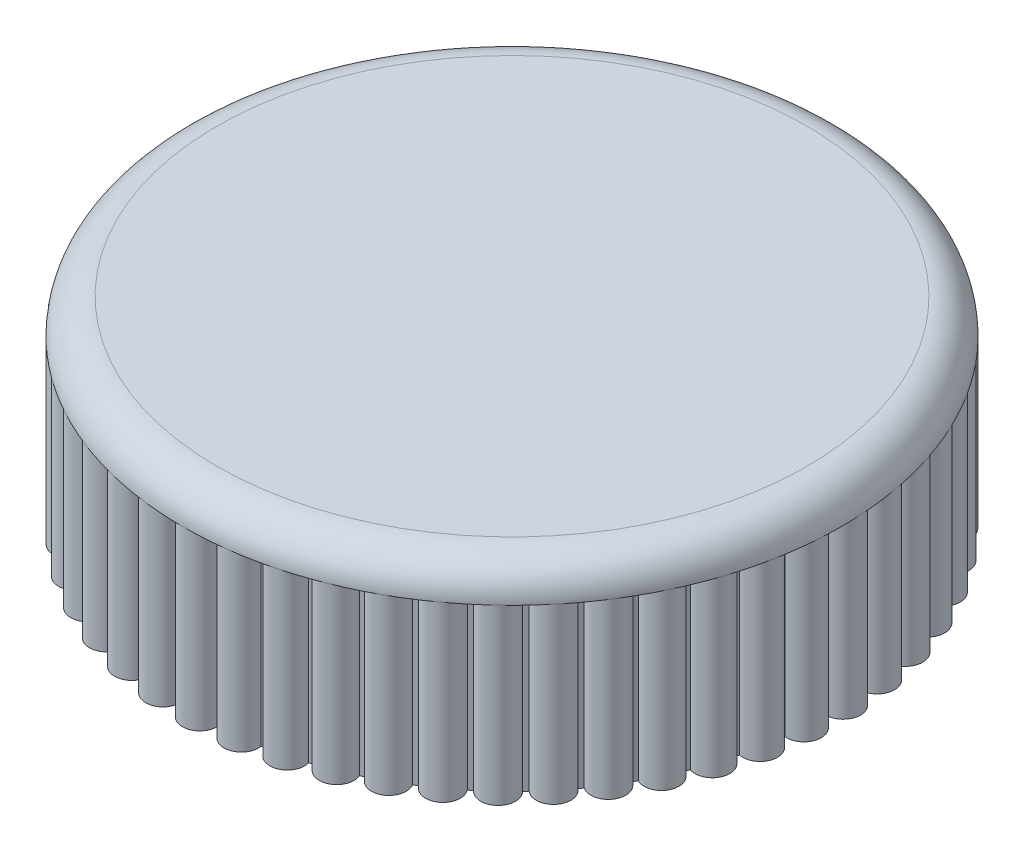
from build123d import *

# Parameters (mm, degrees)
BOSS_EXTRUDE1_DEPTH = 5
SKETCH2_R           = 9.5
BOSS_EXTRUDE2_DEPTH = 1
FILLET1_R           = 1
SKETCH3_R           = 7.5
CUT_EXTRUDE1_DEPTH  = 4


with BuildPart() as part:
    # Sketch1 → Boss-Extrude1 (new body)
    with BuildSketch(Plane(origin=(0, 0, 0), x_dir=(1, 0, 0), z_dir=(0, 1, 0))):
        with BuildLine():
            ThreePointArc((-0.499807062, 8.986111111), (-0.565114676, 8.982240556), (-0.630392429, 8.977895376))
            ThreePointArc((-0.630392429, 8.977895376), (-1.190665719, 9.425089662), (-1.622124296, 8.852610506))
            ThreePointArc((-1.622124296, 8.852610506), (-1.686431831, 8.840585257), (-1.750650255, 8.828092868))
            ThreePointArc((-1.750650255, 8.828092868), (-2.362553928, 9.201540031), (-2.718859662, 8.579498945))
            ThreePointArc((-2.718859662, 8.579498945), (-2.781152949, 8.559508647), (-2.84329928, 8.539066062))
            ThreePointArc((-2.84329928, 8.539066062), (-3.497183251, 8.832876616), (-3.772716986, 8.17108356))
            ThreePointArc((-3.772716986, 8.17108356), (-3.832013624, 8.143443472), (-3.891107777, 8.115373083))
            ThreePointArc((-3.891107777, 8.115373083), (-4.576659904, 8.32491346), (-4.76707631, 7.633805306))
            ThreePointArc((-4.76707631, 7.633805306), (-4.822441155, 7.59895133), (-4.87755118, 7.563695822))
            ThreePointArc((-4.87755118, 7.563695822), (-5.583959897, 7.685661447), (-5.686255993, 6.976137382))
            ThreePointArc((-5.686255993, 6.976137382), (-5.736815908, 6.934619185), (-5.787072687, 6.89273456))
            ThreePointArc((-5.787072687, 6.89273456), (-6.503197506, 6.925201961), (-6.515760022, 6.208451605))
            ThreePointArc((-6.515760022, 6.208451605), (-6.560717647, 6.160923953), (-6.605328601, 6.113070757))
            ThreePointArc((-6.605328601, 6.113070757), (-7.319875806, 6.055527903), (-7.242506623, 5.342854837))
            ThreePointArc((-7.242506623, 5.342854837), (-7.281152949, 5.290067271), (-7.319414537, 5.237000175))
            ThreePointArc((-7.319414537, 5.237000175), (-8.021115292, 5.090354552), (-7.855034569, 4.392998057))
            ThreePointArc((-7.855034569, 4.392998057), (-7.88676012, 4.335783067), (-7.918068933, 4.278338973))
            ThreePointArc((-7.918068933, 4.278338973), (-8.595856998, 4.04490327), (-8.343683926, 3.373861073))
            ThreePointArc((-8.343683926, 3.373861073), (-8.367988373, 3.313120974), (-8.391850652, 3.252205809))
            ThreePointArc((-8.391850652, 3.252205809), (-9.035036905, 2.935661447), (-8.700748404, 2.301516284))
            ThreePointArc((-8.700748404, 2.301516284), (-8.71724845, 2.238208984), (-8.733287874, 2.174783417))
            ThreePointArc((-8.733287874, 2.174783417), (-9.331728882, 1.780122489), (-8.920596882, 1.192875209))
            ThreePointArc((-8.920596882, 1.192875209), (-8.929032312, 1.127999102), (-8.936995928, 1.063063392))
            ThreePointArc((-8.936995928, 1.063063392), (-9.48125392, 0.596509936), (-8.999762219, 0.065421779))
            ThreePointArc((-8.999762219, 0.065421779), (-9, 0), (-8.999762219, -0.065421779))
            ThreePointArc((-8.999762219, -0.065421779), (-9.48125392, -0.596509936), (-8.936995928, -1.063063392))
            ThreePointArc((-8.936995928, -1.063063392), (-8.929032312, -1.127999102), (-8.920596882, -1.192875209))
            ThreePointArc((-8.920596882, -1.192875209), (-9.331728882, -1.780122489), (-8.733287874, -2.174783417))
            ThreePointArc((-8.733287874, -2.174783417), (-8.71724845, -2.238208984), (-8.700748404, -2.301516284))
            ThreePointArc((-8.700748404, -2.301516284), (-9.035036905, -2.935661447), (-8.391850652, -3.252205809))
            ThreePointArc((-8.391850652, -3.252205809), (-8.367988373, -3.313120974), (-8.343683926, -3.373861073))
            ThreePointArc((-8.343683926, -3.373861073), (-8.595856998, -4.04490327), (-7.918068933, -4.278338973))
            ThreePointArc((-7.918068933, -4.278338973), (-7.88676012, -4.335783067), (-7.855034569, -4.392998057))
            ThreePointArc((-7.855034569, -4.392998057), (-8.021115292, -5.090354552), (-7.319414537, -5.237000175))
            ThreePointArc((-7.319414537, -5.237000175), (-7.281152949, -5.290067271), (-7.242506623, -5.342854837))
            ThreePointArc((-7.242506623, -5.342854837), (-7.319875806, -6.055527903), (-6.605328601, -6.113070757))
            ThreePointArc((-6.605328601, -6.113070757), (-6.560717647, -6.160923953), (-6.515760022, -6.208451605))
            ThreePointArc((-6.515760022, -6.208451605), (-6.503197506, -6.925201961), (-5.787072687, -6.89273456))
            ThreePointArc((-5.787072687, -6.89273456), (-5.736815908, -6.934619185), (-5.686255993, -6.976137382))
            ThreePointArc((-5.686255993, -6.976137382), (-5.583959897, -7.685661447), (-4.87755118, -7.563695822))
            ThreePointArc((-4.87755118, -7.563695822), (-4.822441155, -7.59895133), (-4.76707631, -7.633805306))
            ThreePointArc((-4.76707631, -7.633805306), (-4.576659904, -8.32491346), (-3.891107777, -8.115373083))
            ThreePointArc((-3.891107777, -8.115373083), (-3.832013624, -8.143443472), (-3.772716986, -8.17108356))
            ThreePointArc((-3.772716986, -8.17108356), (-3.497183251, -8.832876616), (-2.84329928, -8.539066062))
            ThreePointArc((-2.84329928, -8.539066062), (-2.781152949, -8.559508647), (-2.718859662, -8.579498945))
            ThreePointArc((-2.718859662, -8.579498945), (-2.362553928, -9.201540031), (-1.750650255, -8.828092868))
            ThreePointArc((-1.750650255, -8.828092868), (-1.686431831, -8.840585257), (-1.622124296, -8.852610506))
            ThreePointArc((-1.622124296, -8.852610506), (-1.190665719, -9.425089662), (-0.630392429, -8.977895376))
            ThreePointArc((-0.630392429, -8.977895376), (-0.565114676, -8.982240556), (-0.499807062, -8.986111111))
            ThreePointArc((-0.499807062, -8.986111111), (0, -9.5), (0.499807062, -8.986111111))
            ThreePointArc((0.499807062, -8.986111111), (0.565114676, -8.982240556), (0.630392429, -8.977895376))
            ThreePointArc((0.630392429, -8.977895376), (1.190665719, -9.425089662), (1.622124296, -8.852610506))
            ThreePointArc((1.622124296, -8.852610506), (1.686431831, -8.840585257), (1.750650255, -8.828092868))
            ThreePointArc((1.750650255, -8.828092868), (2.362553928, -9.201540031), (2.718859662, -8.579498945))
            ThreePointArc((2.718859662, -8.579498945), (2.781152949, -8.559508647), (2.84329928, -8.539066062))
            ThreePointArc((2.84329928, -8.539066062), (3.497183251, -8.832876616), (3.772716986, -8.17108356))
            ThreePointArc((3.772716986, -8.17108356), (3.832013624, -8.143443472), (3.891107777, -8.115373083))
            ThreePointArc((3.891107777, -8.115373083), (4.576659904, -8.32491346), (4.76707631, -7.633805306))
            ThreePointArc((4.76707631, -7.633805306), (4.822441155, -7.59895133), (4.87755118, -7.563695822))
            ThreePointArc((4.87755118, -7.563695822), (5.583959897, -7.685661447), (5.686255993, -6.976137382))
            ThreePointArc((5.686255993, -6.976137382), (5.736815908, -6.934619185), (5.787072687, -6.89273456))
            ThreePointArc((5.787072687, -6.89273456), (6.503197506, -6.925201961), (6.515760022, -6.208451605))
            ThreePointArc((6.515760022, -6.208451605), (6.560717647, -6.160923953), (6.605328601, -6.113070757))
            ThreePointArc((6.605328601, -6.113070757), (7.319875806, -6.055527903), (7.242506623, -5.342854837))
            ThreePointArc((7.242506623, -5.342854837), (7.281152949, -5.290067271), (7.319414537, -5.237000175))
            ThreePointArc((7.319414537, -5.237000175), (8.021115292, -5.090354552), (7.855034569, -4.392998057))
            ThreePointArc((7.855034569, -4.392998057), (7.88676012, -4.335783067), (7.918068933, -4.278338973))
            ThreePointArc((7.918068933, -4.278338973), (8.595856998, -4.04490327), (8.343683926, -3.373861073))
            ThreePointArc((8.343683926, -3.373861073), (8.367988373, -3.313120974), (8.391850652, -3.252205809))
            ThreePointArc((8.391850652, -3.252205809), (9.035036905, -2.935661447), (8.700748404, -2.301516284))
            ThreePointArc((8.700748404, -2.301516284), (8.71724845, -2.238208984), (8.733287874, -2.174783417))
            ThreePointArc((8.733287874, -2.174783417), (9.331728882, -1.780122489), (8.920596882, -1.192875209))
            ThreePointArc((8.920596882, -1.192875209), (8.929032312, -1.127999102), (8.936995928, -1.063063392))
            ThreePointArc((8.936995928, -1.063063392), (9.48125392, -0.596509936), (8.999762219, -0.065421779))
            ThreePointArc((8.999762219, -0.065421779), (9, 0), (8.999762219, 0.065421779))
            ThreePointArc((8.999762219, 0.065421779), (9.48125392, 0.596509936), (8.936995928, 1.063063392))
            ThreePointArc((8.936995928, 1.063063392), (8.929032312, 1.127999102), (8.920596882, 1.192875209))
            ThreePointArc((8.920596882, 1.192875209), (9.331728882, 1.780122489), (8.733287874, 2.174783417))
            ThreePointArc((8.733287874, 2.174783417), (8.71724845, 2.238208984), (8.700748404, 2.301516284))
            ThreePointArc((8.700748404, 2.301516284), (9.035036905, 2.935661447), (8.391850652, 3.252205809))
            ThreePointArc((8.391850652, 3.252205809), (8.367988373, 3.313120974), (8.343683926, 3.373861073))
            ThreePointArc((8.343683926, 3.373861073), (8.595856998, 4.04490327), (7.918068933, 4.278338973))
            ThreePointArc((7.918068933, 4.278338973), (7.88676012, 4.335783067), (7.855034569, 4.392998057))
            ThreePointArc((7.855034569, 4.392998057), (8.021115292, 5.090354552), (7.319414537, 5.237000175))
            ThreePointArc((7.319414537, 5.237000175), (7.281152949, 5.290067271), (7.242506623, 5.342854837))
            ThreePointArc((7.242506623, 5.342854837), (7.319875806, 6.055527903), (6.605328601, 6.113070757))
            ThreePointArc((6.605328601, 6.113070757), (6.560717647, 6.160923953), (6.515760022, 6.208451605))
            ThreePointArc((6.515760022, 6.208451605), (6.503197506, 6.925201961), (5.787072687, 6.89273456))
            ThreePointArc((5.787072687, 6.89273456), (5.736815908, 6.934619185), (5.686255993, 6.976137382))
            ThreePointArc((5.686255993, 6.976137382), (5.583959897, 7.685661447), (4.87755118, 7.563695822))
            ThreePointArc((4.87755118, 7.563695822), (4.822441155, 7.59895133), (4.76707631, 7.633805306))
            ThreePointArc((4.76707631, 7.633805306), (4.576659904, 8.32491346), (3.891107777, 8.115373083))
            ThreePointArc((3.891107777, 8.115373083), (3.832013624, 8.143443472), (3.772716986, 8.17108356))
            ThreePointArc((3.772716986, 8.17108356), (3.497183251, 8.832876616), (2.84329928, 8.539066062))
            ThreePointArc((2.84329928, 8.539066062), (2.781152949, 8.559508647), (2.718859662, 8.579498945))
            ThreePointArc((2.718859662, 8.579498945), (2.362553928, 9.201540031), (1.750650255, 8.828092868))
            ThreePointArc((1.750650255, 8.828092868), (1.686431831, 8.840585257), (1.622124296, 8.852610506))
            ThreePointArc((1.622124296, 8.852610506), (1.190665719, 9.425089662), (0.630392429, 8.977895376))
            ThreePointArc((0.630392429, 8.977895376), (0.565114676, 8.982240556), (0.499807062, 8.986111111))
            ThreePointArc((0.499807062, 8.986111111), (0, 9.5), (-0.499807062, 8.986111111))
        make_face()
    extrude(amount=BOSS_EXTRUDE1_DEPTH)

    # Sketch2 → Boss-Extrude2 (add)
    with BuildSketch(Plane(origin=(0, 5, 0), x_dir=(1, 0, 0), z_dir=(0, 1, 0))):
        with Locations(Location((0, 0, 0), (0, 0, 270))):
            Circle(SKETCH2_R)
    extrude(amount=BOSS_EXTRUDE2_DEPTH)

    # Fillet1
    fillet1_edges = [part.edges().sort_by_distance(p)[0] for p in [
        (0, 6, -9.5),
    ]]
    fillet(fillet1_edges, radius=FILLET1_R - 0.0001)  # a hair under: the kernel refuses the full size

    # Sketch3 → Cut-Extrude1 (cut)
    with BuildSketch(Plane.XZ):
        with Locations(Location((0, 0, 0), (0, 0, 270))):
            Circle(SKETCH3_R)
    extrude(amount=-CUT_EXTRUDE1_DEPTH, mode=Mode.SUBTRACT)


solid = part.part
